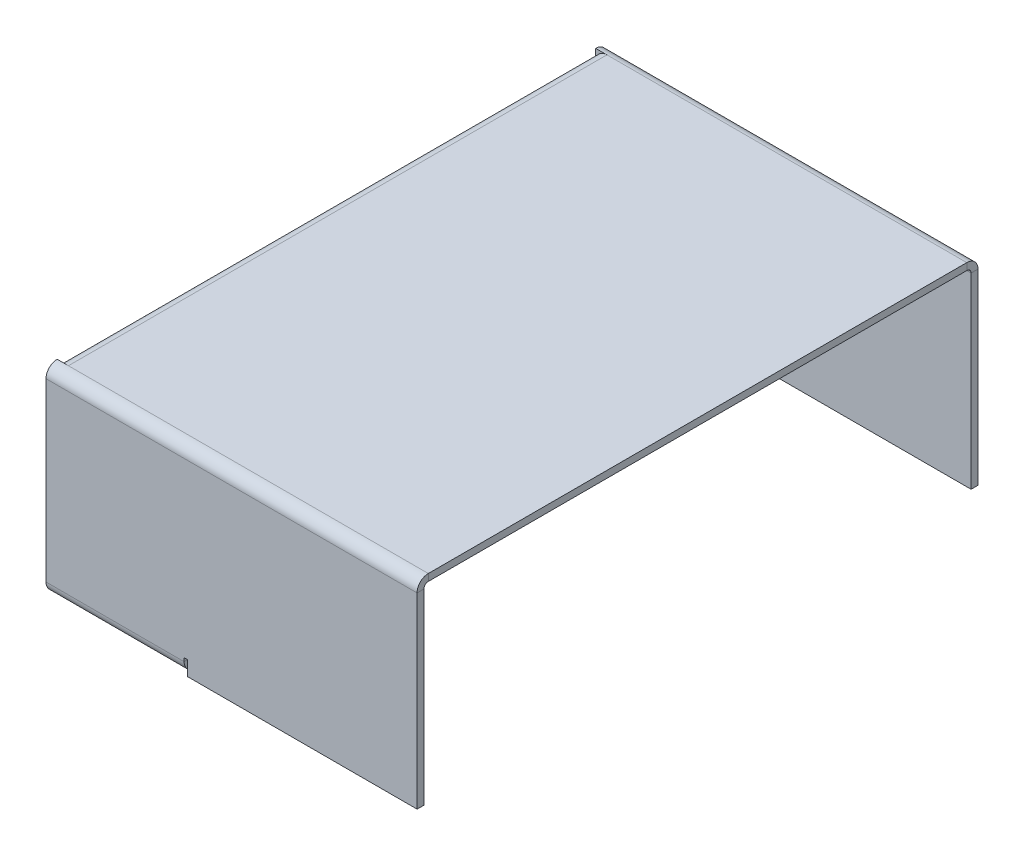
from build123d import *

# Parameters (mm, degrees)
SKETCH_1_W                          = 43
SKETCH_1_H                          = 65
SM_BASE_FLANGE_1_DEPTH              = 0.8
SM_EDGE_FLANGE_1_STRIP_W            = 4.2
SM_EDGE_FLANGE_1_STRIP_H            = 0.8
SM_EDGE_FLANGE_1_STRIP_CUT_DEPTH    = 43
SM_EDGE_FLANGE_1_STRIP_2_W          = 4.2
SM_EDGE_FLANGE_1_STRIP_2_H          = 0.8
SM_EDGE_FLANGE_1_STRIP_CUT_2_DEPTH  = 43
SM_EDGE_FLANGE_1_DEPTH              = 43
SM_EDGE_FLANGE_1_BEND_DEPTH         = 43
SM_EDGE_FLANGE_2_STRIP_W            = 4.2
SM_EDGE_FLANGE_2_STRIP_H            = 0.8
SM_EDGE_FLANGE_2_STRIP_CUT_DEPTH    = 62.4
SM_EDGE_FLANGE_2_DEPTH              = 62.4
SM_EDGE_FLANGE_2_PROFILE_W          = 62.4
SM_EDGE_FLANGE_2_PROFILE_H          = 6.7
SM_EDGE_FLANGE_2_PROFILE_R          = 1.25
SM_EDGE_FLANGE_2_FLAT_DEPTH         = 0.8
SM_EDGE_FLANGE_3_STRIP_W            = 4.2
SM_EDGE_FLANGE_3_STRIP_H            = 0.8
SM_EDGE_FLANGE_3_STRIP_CUT_DEPTH    = 16
SM_EDGE_FLANGE_3_RELIEF_W           = 4.6
SM_EDGE_FLANGE_3_RELIEF_H           = 0.4
SM_EDGE_FLANGE_3_RELIEF_CUT_DEPTH   = 0.8
SM_EDGE_FLANGE_3_STRIP_2_W          = 4.2
SM_EDGE_FLANGE_3_STRIP_2_H          = 0.8
SM_EDGE_FLANGE_3_STRIP_CUT_2_DEPTH  = 16
SM_EDGE_FLANGE_3_RELIEF_2_W         = 4.6
SM_EDGE_FLANGE_3_RELIEF_2_H         = 0.4
SM_EDGE_FLANGE_3_RELIEF_CUT_2_DEPTH = 0.8
SM_EDGE_FLANGE_3_DEPTH              = 16
SM_EDGE_FLANGE_3_BEND_DEPTH         = 16
SKETCH_25_R                         = 3.25
EXTRUDE_1_DEPTH                     = 2
HOLE_WIZARD_M3_1_D                  = 2.5
HOLE_WIZARD_M3_1_DEPTH              = 2.8
FILLET_3_R                          = 5


# Sheet-metal steps are written as plain solids
with BuildPart() as part:
    # Sketch 1 → 基体-法兰1 (new body)
    with BuildSketch(Plane(origin=(0, 0, 0), x_dir=(1, 0, 0), z_dir=(0, 1, 0))):
        with Locations((21.5, 2.708940216)):
            Rectangle(SKETCH_1_W, SKETCH_1_H)
    extrude(amount=-SM_BASE_FLANGE_1_DEPTH)

    # 边线-法兰1 strip (across the edge) → 边线-法兰1 strip cut (cut)
    with BuildSketch(Plane(origin=(0, -0.8, -35.208940216), x_dir=(0, 0, 1), z_dir=(1, 0, 0))):
        with Locations((-0.8, -0.4)):
            Rectangle(SM_EDGE_FLANGE_1_STRIP_W, SM_EDGE_FLANGE_1_STRIP_H)
    extrude(amount=SM_EDGE_FLANGE_1_STRIP_CUT_DEPTH, mode=Mode.SUBTRACT)

    # 边线-法兰1 strip 2 (across the edge) → 边线-法兰1 strip cut 2 (cut)
    with BuildSketch(Plane(origin=(43, -0.8, 29.791059784), x_dir=(0, 0, -1), z_dir=(-1, 0, 0))):
        with Locations((-0.8, -0.4)):
            Rectangle(SM_EDGE_FLANGE_1_STRIP_2_W, SM_EDGE_FLANGE_1_STRIP_2_H)
    extrude(amount=SM_EDGE_FLANGE_1_STRIP_CUT_2_DEPTH, mode=Mode.SUBTRACT)

    # 边线-法兰1 section (across the edge) → 边线-法兰1 (add)
    with BuildSketch(Plane(origin=(0, -0.8, -35.208940216), x_dir=(0, 0, 1), z_dir=(1, 0, 0))):
        with BuildLine():
            Line((0, 0.5), (0, 22.2))
            Line((0, 22.2), (0.8, 22.2))
            Line((0.8, 22.2), (0.8, 0.5))
            ThreePointArc((0.8, 0.5), (0.946446609, 0.146446609), (1.3, 0))
            Line((1.3, 0), (1.3, -0.8))
            ThreePointArc((1.3, -0.8), (0.380761184, -0.419238816), (0, 0.5))
        make_face()
    extrude(amount=SM_EDGE_FLANGE_1_DEPTH)

    # 边线-法兰1 section 2 (across the edge) → 边线-法兰1 bend (add)
    with BuildSketch(Plane(origin=(43, -0.8, 29.791059784), x_dir=(0, 0, -1), z_dir=(-1, 0, 0))):
        with BuildLine():
            Line((0, 0.5), (0, 22.2))
            Line((0, 22.2), (0.8, 22.2))
            Line((0.8, 22.2), (0.8, 0.5))
            ThreePointArc((0.8, 0.5), (0.946446609, 0.146446609), (1.3, 0))
            Line((1.3, 0), (1.3, -0.8))
            ThreePointArc((1.3, -0.8), (0.380761184, -0.419238816), (0, 0.5))
        make_face()
    extrude(amount=SM_EDGE_FLANGE_1_BEND_DEPTH)

    # 边线-法兰2 strip (across the edge) → 边线-法兰2 strip cut (cut)
    with BuildSketch(Plane(origin=(0, -0.8, 28.491059784), x_dir=(1, 0, 0), z_dir=(0, 0, -1))):
        with Locations((-0.8, -0.4)):
            Rectangle(SM_EDGE_FLANGE_2_STRIP_W, SM_EDGE_FLANGE_2_STRIP_H)
    extrude(amount=SM_EDGE_FLANGE_2_STRIP_CUT_DEPTH, mode=Mode.SUBTRACT)

    # 边线-法兰2 bend section (across the edge) → 边线-法兰2 (add)
    with BuildSketch(Plane(origin=(0, -0.8, 28.491059784), x_dir=(1, 0, 0), z_dir=(0, 0, -1))):
        with BuildLine():
            Line((0, 0.5), (0.8, 0.5))
            ThreePointArc((0.8, 0.5), (0.946446609, 0.146446609), (1.3, 0))
            Line((1.3, 0), (1.3, -0.8))
            ThreePointArc((1.3, -0.8), (0.380761184, -0.419238816), (0, 0.5))
        make_face()
    extrude(amount=SM_EDGE_FLANGE_2_DEPTH)

    # 边线-法兰2 profile (on flange) → 边线-法兰2 flat (add)
    with BuildSketch(Plane(origin=(0, -0.8, 0), x_dir=(0, 0, -1), z_dir=(-1, 0, 0))):
        with Locations((2.708940216, 3.85)):
            Rectangle(SM_EDGE_FLANGE_2_PROFILE_W, SM_EDGE_FLANGE_2_PROFILE_H)
        with Locations((19.208940216, 4.2)):
            Circle(SM_EDGE_FLANGE_2_PROFILE_R, mode=Mode.SUBTRACT)
        with Locations((-13.791059784, 4.2)):
            Circle(SM_EDGE_FLANGE_2_PROFILE_R, mode=Mode.SUBTRACT)
    extrude(amount=-SM_EDGE_FLANGE_2_FLAT_DEPTH)

    # 边线-法兰3 strip (across the edge) → 边线-法兰3 strip cut (cut)
    with BuildSketch(Plane(origin=(0, -23, -34.408940216), x_dir=(0, 1, 0), z_dir=(1, 0, 0))):
        with Locations((-0.8, -0.4)):
            Rectangle(SM_EDGE_FLANGE_3_STRIP_W, SM_EDGE_FLANGE_3_STRIP_H)
    extrude(amount=SM_EDGE_FLANGE_3_STRIP_CUT_DEPTH, mode=Mode.SUBTRACT)

    # 边线-法兰3 relief (on the sheet) → 边线-法兰3 relief cut (cut)
    with BuildSketch(Plane(origin=(0, -21.7, -34.408940216), x_dir=(0, 1, 0), z_dir=(0, 0, 1))):
        with Locations((-1.9, -16.2)):
            Rectangle(SM_EDGE_FLANGE_3_RELIEF_W, SM_EDGE_FLANGE_3_RELIEF_H)
    extrude(amount=-SM_EDGE_FLANGE_3_RELIEF_CUT_DEPTH, mode=Mode.SUBTRACT)

    # 边线-法兰3 strip 2 (across the edge) → 边线-法兰3 strip cut 2 (cut)
    with BuildSketch(Plane(origin=(16, -23, 28.991059784), x_dir=(0, 1, 0), z_dir=(-1, 0, 0))):
        with Locations((-0.8, -0.4)):
            Rectangle(SM_EDGE_FLANGE_3_STRIP_2_W, SM_EDGE_FLANGE_3_STRIP_2_H)
    extrude(amount=SM_EDGE_FLANGE_3_STRIP_CUT_2_DEPTH, mode=Mode.SUBTRACT)

    # 边线-法兰3 relief 2 (on the sheet) → 边线-法兰3 relief cut 2 (cut)
    with BuildSketch(Plane(origin=(16, -21.7, 28.991059784), x_dir=(0, 1, 0), z_dir=(0, 0, -1))):
        with Locations((-1.9, 0.2)):
            Rectangle(SM_EDGE_FLANGE_3_RELIEF_2_W, SM_EDGE_FLANGE_3_RELIEF_2_H)
    extrude(amount=-SM_EDGE_FLANGE_3_RELIEF_CUT_2_DEPTH, mode=Mode.SUBTRACT)

    # 边线-法兰3 section (across the edge) → 边线-法兰3 (add)
    with BuildSketch(Plane(origin=(0, -23, -34.408940216), x_dir=(0, 1, 0), z_dir=(1, 0, 0))):
        with BuildLine():
            Line((0, 0.5), (0, 8))
            Line((0, 8), (0.8, 8))
            Line((0.8, 8), (0.8, 0.5))
            ThreePointArc((0.8, 0.5), (0.946446609, 0.146446609), (1.3, 0))
            Line((1.3, 0), (1.3, -0.8))
            ThreePointArc((1.3, -0.8), (0.380761184, -0.419238816), (0, 0.5))
        make_face()
    extrude(amount=SM_EDGE_FLANGE_3_DEPTH)

    # 边线-法兰3 section 2 (across the edge) → 边线-法兰3 bend (add)
    with BuildSketch(Plane(origin=(16, -23, 28.991059784), x_dir=(0, 1, 0), z_dir=(-1, 0, 0))):
        with BuildLine():
            Line((0, 0.5), (0, 8))
            Line((0, 8), (0.8, 8))
            Line((0.8, 8), (0.8, 0.5))
            ThreePointArc((0.8, 0.5), (0.946446609, 0.146446609), (1.3, 0))
            Line((1.3, 0), (1.3, -0.8))
            ThreePointArc((1.3, -0.8), (0.380761184, -0.419238816), (0, 0.5))
        make_face()
    extrude(amount=SM_EDGE_FLANGE_3_BEND_DEPTH)

    # 草图25 → 凸台-拉伸1 (add)
    with BuildSketch(Plane(origin=(0, -22.2, 0), x_dir=(1, 0, 0), z_dir=(0, 1, 0))):
        with Locations(Location((9, -24.791059784, 0), (0, 0, 270))):
            Circle(SKETCH_25_R)
        with Locations(Location((9, 30.208940216, 0), (0, 0, 270))):
            Circle(SKETCH_25_R)
    extrude(amount=EXTRUDE_1_DEPTH)

    # M3 螺纹孔1
    with Locations(Plane(origin=(0, -23, 0), x_dir=(-1, 0, 0), z_dir=(0, -1, 0))):
        with Locations((-9, -24.791059784), (-9, 30.208940216)):
            Hole(HOLE_WIZARD_M3_1_D / 2, depth=HOLE_WIZARD_M3_1_DEPTH)

    # 圆角3
    fillet_3_edges = [part.edges().sort_by_distance(p)[0] for p in [
        (0, -22.6, -26.408940216),
        (16, -22.6, -26.408940216),
        (16, -22.6, 20.991059784),
        (0, -22.6, 20.991059784),
    ]]
    fillet(fillet_3_edges, radius=FILLET_3_R)


solid = part.part
